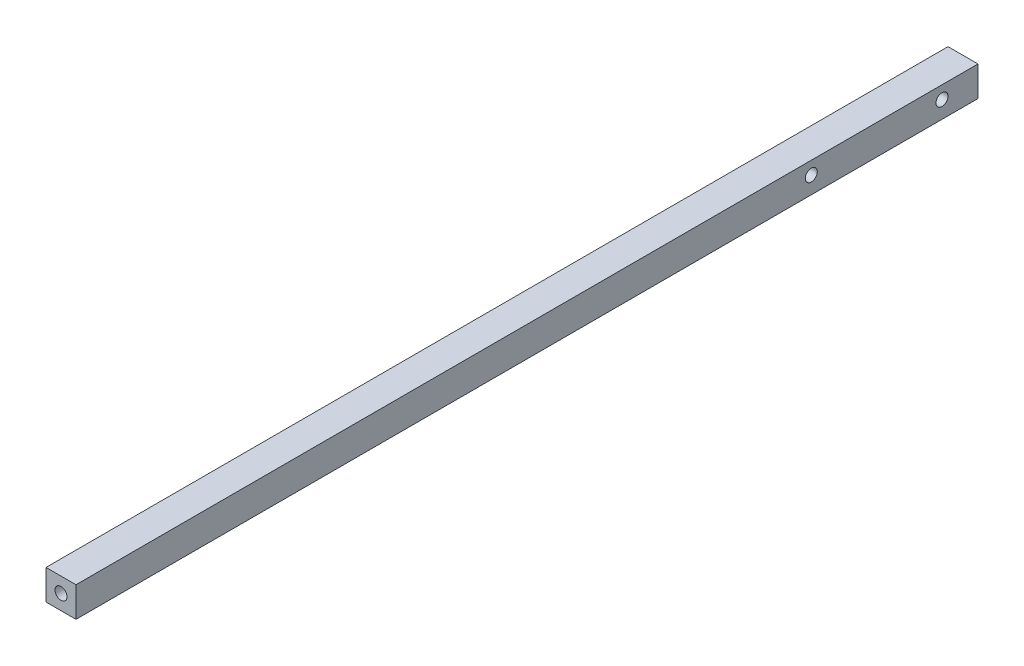
from build123d import *

# Parameters (mm, degrees)
ESQUISSE1_W             = 10
ESQUISSE1_H             = 10
BOSS_EXTRU_1_DEPTH      = 300.81
ESQUISSE2_R             = 2
ENL_V_MAT_EXTRU_1_DEPTH = 302.142252266
ESQUISSE3_R             = 2
ENL_V_MAT_EXTRU_2_DEPTH = 6
ENL_V_START             = -6
ESQUISSE4_R             = 2
ENL_V_MAT_EXTRU_3_DEPTH = 6


with BuildPart() as part:
    # Esquisse1 → Boss.-Extru.1 (new body)
    with BuildSketch(Plane.XY):
        with Locations((5, 5)):
            Rectangle(ESQUISSE1_W, ESQUISSE1_H)
    extrude(amount=BOSS_EXTRU_1_DEPTH)

    # Esquisse2 → Enlèv. mat.-Extru.1 (cut, through all)
    with BuildSketch(Plane.ZY):
        with Locations((12, 5.7)):
            Circle(ESQUISSE2_R)
        with Locations((55.6, 5.7)):
            Circle(ESQUISSE2_R)
    extrude(amount=-ENL_V_MAT_EXTRU_1_DEPTH, mode=Mode.SUBTRACT)

    # Esquisse3 → Enlèv. mat.-Extru.2 (cut)
    with BuildSketch(Plane(origin=(0, 0, 0), x_dir=(-1, 0, 0), z_dir=(0, 0, -1))):
        with Locations((-5, 5)):
            Circle(ESQUISSE3_R)
    extrude(amount=-ENL_V_MAT_EXTRU_2_DEPTH, mode=Mode.SUBTRACT)

    # Esquisse4 → Enlèv. mat.-Extru.3 (cut)
    with BuildSketch(Plane.XY.offset(300.81).offset(ENL_V_START)):
        with Locations((5, 5)):
            Circle(ESQUISSE4_R)
    extrude(amount=ENL_V_MAT_EXTRU_3_DEPTH, mode=Mode.SUBTRACT)


solid = part.part
